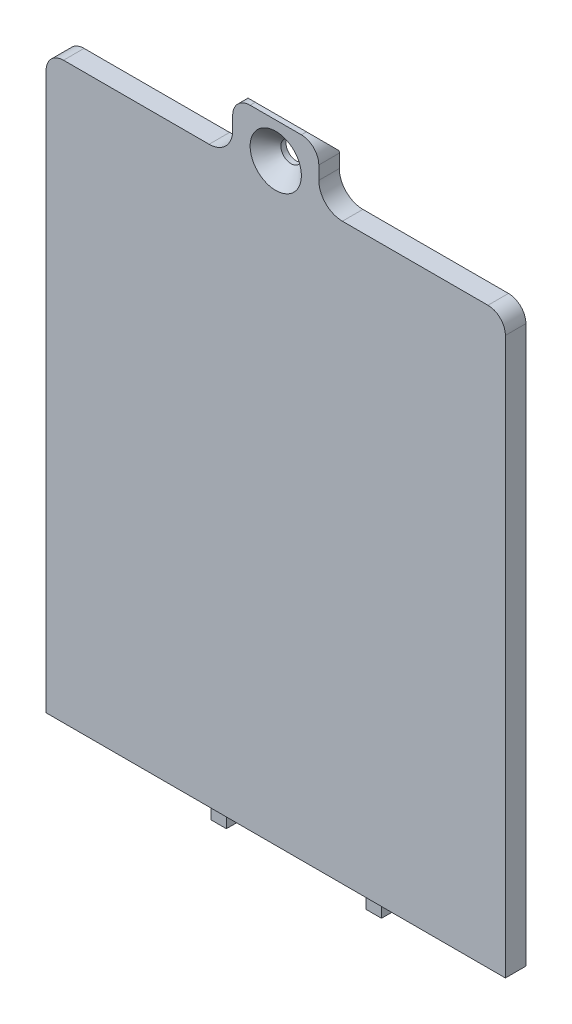
from build123d import *

# Parameters (mm, degrees)
BOSS_EXTRUDE1_DEPTH = 2
CUT_EXTRUDE1_REACH  = 43.449
SKETCH2_R           = 1
SKETCH3_W           = 42.8
SKETCH3_H           = 53.28
CUT_EXTRUDE2_DEPTH  = 1
SKETCH4_W           = 1.5
SKETCH4_H           = 57.28
BOSS_EXTRUDE2_DEPTH = 3.5
SKETCH5_W           = 1
SKETCH5_H           = 3
CUT_EXTRUDE3_DEPTH  = 16.633
CHAMFER1_SIZE       = 1
CHAMFER2_SIZE       = 2.5
CHAMFER3_SIZE       = 1.5
CHAMFER4_SIZE       = 1.5


# Some blends are built 0.0001 mm under size
with BuildPart() as part:
    # Sketch1 → Boss-Extrude1 (new body)
    with BuildSketch(Plane.XY):
        with BuildLine():
            Line((-23.2, -26.99), (-23.2, 27.29))
            ThreePointArc((-23.2, 27.29), (-22.702081528, 28.492081528), (-21.5, 28.99))
            Line((-21.5, 28.99), (-7.3, 28.99))
            ThreePointArc((-7.3, 28.99), (-5.673654403, 29.663654403), (-5, 31.29))
            Line((-5, 31.29), (-5, 32.59))
            ThreePointArc((-5, 32.59), (-4.502081528, 33.792081528), (-3.3, 34.29))
            Line((-3.3, 34.29), (1.7, 34.29))
            ThreePointArc((1.7, 34.29), (2.902081528, 33.792081528), (3.4, 32.59))
            Line((3.4, 32.59), (3.4, 31.29))
            ThreePointArc((3.4, 31.29), (4.073654403, 29.663654403), (5.7, 28.99))
            Line((5.7, 28.99), (19.9, 28.99))
            ThreePointArc((19.9, 28.99), (21.102081528, 28.492081528), (21.6, 27.29))
            Line((21.6, 27.29), (21.6, -26.99))
            Line((21.6, -26.99), (-23.2, -26.99))
        make_face()
    extrude(amount=BOSS_EXTRUDE1_DEPTH)

    # Sketch2 → Cut-Extrude1 (cut, up to next)
    with BuildSketch(Plane(origin=(0, 0, 0), x_dir=(-1, 0, 0), z_dir=(0, 0, -1)), mode=Mode.PRIVATE) as cut_extrude1_sk1:
        with Locations((0.8, 30.84)):
            Circle(SKETCH2_R)
    cut_extrude1_tool1 = extrude(cut_extrude1_sk1.sketch, amount=-CUT_EXTRUDE1_REACH, mode=Mode.PRIVATE) & part.part
    add(cut_extrude1_tool1.solids().sort_by_distance((-0.8, 30.84, 0))[0], mode=Mode.SUBTRACT)

    # Sketch3 → Cut-Extrude2 (cut)
    with BuildSketch(Plane(origin=(0, 0, 0), x_dir=(-1, 0, 0), z_dir=(0, 0, -1))):
        with Locations((0.8, 0.65)):
            Rectangle(SKETCH3_W, SKETCH3_H)
    extrude(amount=-CUT_EXTRUDE2_DEPTH, mode=Mode.SUBTRACT)

    # Sketch4 → Boss-Extrude2 (add)
    with BuildSketch(Plane(origin=(0, 0, 1), x_dir=(-1, 0, 0), z_dir=(0, 0, -1))):
        with Locations((-6.7665, -1.35)):
            Rectangle(SKETCH4_W, SKETCH4_H)
        with Locations((8.3665, -1.35)):
            Rectangle(SKETCH4_W, SKETCH4_H)
    extrude(amount=BOSS_EXTRUDE2_DEPTH)

    # Sketch5 → Cut-Extrude3 (cut)
    with BuildSketch(Plane(origin=(7.5165, 0, 0), x_dir=(0, 0, -1), z_dir=(1, 0, 0))):
        with Locations((-0.5, -28.49)):
            Rectangle(SKETCH5_W, SKETCH5_H)
    extrude(amount=-CUT_EXTRUDE3_DEPTH, mode=Mode.SUBTRACT)

    # Chamfer1
    chamfer1_edges = [part.edges().sort_by_distance(p)[0] for p in [
        (6.7665, -29.99, -2.5),
        (-8.3665, -29.99, -2.5),
    ]]
    chamfer(chamfer1_edges, length=CHAMFER1_SIZE)

    # Chamfer2
    chamfer2_edges = [part.edges().sort_by_distance(p)[0] for p in [
        (6.7665, 27.29, -2.5),
        (-8.3665, 27.29, -2.5),
    ]]
    chamfer(chamfer2_edges, length=CHAMFER2_SIZE - 0.0001)  # a hair under: the kernel refuses the full size

    # Chamfer3
    # the kernel refuses this chamfer: 1.5 mm, written as the material it takes off along each edge
    with BuildSketch(Plane(origin=(-7.157524482, 34.29, 0), x_dir=(0, -0.9996219169112968, -0.02749587661058636), z_dir=(1, 0, 0))) as chamfer3_piece_1:
        Polygon((CHAMFER3_SIZE * 0.999621916911, -CHAMFER3_SIZE * 0.0274958766106), (-CHAMFER3_SIZE * 0.0274958766106, -CHAMFER3_SIZE * 0.999621916911), (0, 0), align=None)
    extrude(amount=12.715048964, mode=Mode.SUBTRACT)

    # Chamfer4
    chamfer4_edges = [part.edges().sort_by_distance(p)[0] for p in [
        (0.2, 30.84, 2),
    ]]
    chamfer(chamfer4_edges, length=CHAMFER4_SIZE)


solid = part.part
